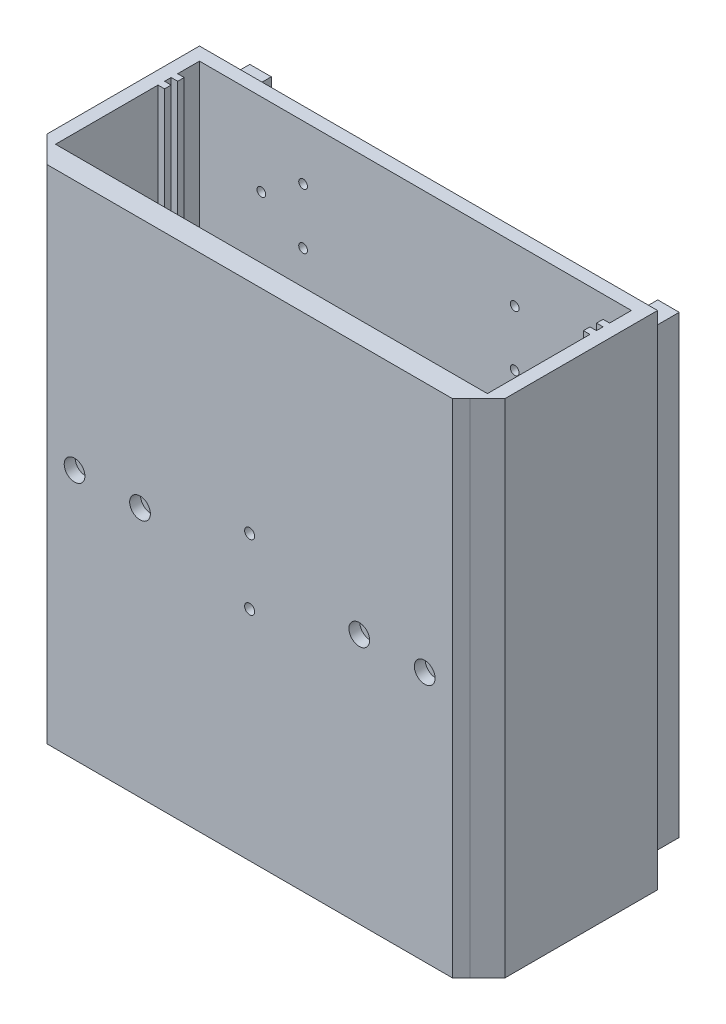
from build123d import *

# Parameters (mm, degrees)
SKETCH_1_W           = 210
SKETCH_1_H           = 230
EXTRUDE_1_DEPTH      = 6
SKETCH_2_W           = 9.85
SKETCH_2_H           = 208.5
EXTRUDE_3_DEPTH      = 15
SKETCH_3_R           = 2
CUT_EXTRUDE_1_DEPTH  = 10
SKETCH_17_W          = 6
SKETCH_17_H          = 230
EXTRUDE_9_DEPTH      = 66
EXTRUDE_10_DEPTH     = 6
CHAMFER_3_SIZE       = 8
SKETCH_21_R          = 2.3
CUT_EXTRUDE_9_DEPTH  = 6
SKETCH_34_R          = 2.25
CUT_EXTRUDE_14_DEPTH = 30
SKETCH_36_R          = 2.25
CUT_EXTRUDE_15_DEPTH = 30
SKETCH_51_W          = 194
SKETCH_51_H          = 230
EXTRUDE_22_DEPTH     = 4
CHAMFER_6_SIZE       = 4
CUT_EXTRUDE_START    = -5
SKETCH_54_R          = 4.75
SKETCH_54_R_2        = 2.3
CUT_EXTRUDE_21_DEPTH = 5
CUT_EXTRUDE_23_REACH = 324.062
SKETCH_60_W          = 25
SKETCH_60_H          = 30
SKETCH_61_W          = 3
SKETCH_61_H          = 3
EXTRUDE_25_DEPTH     = 230
SKETCH_63_W          = 5
SKETCH_63_H          = 8
EXTRUDE_26_DEPTH     = 3
SKETCH_65_W          = 5
SKETCH_65_H          = 8
EXTRUDE_27_DEPTH     = 3
SKETCH_64_R          = 1.15
CUT_EXTRUDE_24_DEPTH = 9
SKETCH_66_W          = 5
SKETCH_66_H          = 8
EXTRUDE_28_DEPTH     = 3
SKETCH_67_W          = 5
SKETCH_67_H          = 8
EXTRUDE_29_DEPTH     = 3
SKETCH_68_R          = 1.15
CUT_EXTRUDE_25_DEPTH = 9


with BuildPart() as part:
    # 草图1 → 凸台-拉伸1 (new body)
    with BuildSketch(Plane.XY):
        with Locations((105, 115)):
            Rectangle(SKETCH_1_W, SKETCH_1_H)
    extrude(amount=EXTRUDE_1_DEPTH)

    # 草图2 → 凸台-拉伸3 (add)
    with BuildSketch(Plane(origin=(0, 0, 0), x_dir=(-1, 0, 0), z_dir=(0, 0, -1))):
        with Locations((-200, 115)):
            Rectangle(SKETCH_2_W, SKETCH_2_H)
        with Locations((-13, 115)):
            Rectangle(SKETCH_2_W, SKETCH_2_H)
    extrude(amount=EXTRUDE_3_DEPTH)

    # 草图3 → 切除-拉伸1 (cut)
    with BuildSketch(Plane(origin=(0, 0, 0), x_dir=(-1, 0, 0), z_dir=(0, 0, -1))):
        with Locations((-169.6425573, 192.25)):
            Circle(SKETCH_3_R)
        with Locations((-150.5, 205)):
            Circle(SKETCH_3_R)
        with Locations((-150.5, 179.5)):
            Circle(SKETCH_3_R)
        with Locations(Location((-150.5, 50.5, 0), (0, 0, 180))):
            Circle(SKETCH_3_R)
        with Locations(Location((-150.5, 25, 0), (0, 0, 180))):
            Circle(SKETCH_3_R)
        with Locations(Location((-169.6425573, 37.75, 0), (0, 0, 180))):
            Circle(SKETCH_3_R)
        with Locations((-34.3574427, 192.25)):
            Circle(SKETCH_3_R)
        with Locations((-53.5, 205)):
            Circle(SKETCH_3_R)
        with Locations((-53.5, 179.5)):
            Circle(SKETCH_3_R)
        with Locations(Location((-53.5, 50.5, 0), (0, 0, 180))):
            Circle(SKETCH_3_R)
        with Locations(Location((-53.5, 25, 0), (0, 0, 180))):
            Circle(SKETCH_3_R)
        with Locations(Location((-34.3574427, 37.75, 0), (0, 0, 180))):
            Circle(SKETCH_3_R)
    extrude(amount=-CUT_EXTRUDE_1_DEPTH, mode=Mode.SUBTRACT)

    # 草图17 → 凸台-拉伸9 (add)
    with BuildSketch(Plane.XY.offset(6)):
        with Locations((3, 115)):
            Rectangle(SKETCH_17_W, SKETCH_17_H)
        with Locations((207, 115)):
            Rectangle(SKETCH_17_W, SKETCH_17_H)
    extrude(amount=EXTRUDE_9_DEPTH)

    # 草图18 → 凸台-拉伸10 (add)
    with BuildSketch(Plane.XY.offset(72)):
        Polygon((210, 230), (204, 230), (6, 230), (0, 230), (0, 0), (6, 0), (204, 0), (210, 0), align=None)
    extrude(amount=EXTRUDE_10_DEPTH)

    # 倒角3
    chamfer_3_edges = [part.edges().sort_by_distance(p)[0] for p in [
        (210, 115, 78),
        (0, 115, 78),
    ]]
    chamfer(chamfer_3_edges, length=CHAMFER_3_SIZE)

    # 草图21 → 切除-拉伸9 (cut)
    with BuildSketch(Plane.XY.offset(72)):
        with Locations((105, 130)):
            Circle(SKETCH_21_R)
        with Locations((105, 100)):
            Circle(SKETCH_21_R)
    extrude(amount=CUT_EXTRUDE_9_DEPTH, mode=Mode.SUBTRACT)

    # 草图34 → 切除-拉伸14 (cut)
    with BuildSketch(Plane(origin=(0, 0, 72), x_dir=(-1, 0, 0), z_dir=(0, 0, -1))):
        with Locations((-185.25, 115)):
            Circle(SKETCH_34_R)
        with Locations((-155.25, 115)):
            Circle(SKETCH_34_R)
    extrude(amount=-CUT_EXTRUDE_14_DEPTH, mode=Mode.SUBTRACT)

    # 草图36 → 切除-拉伸15 (cut)
    with BuildSketch(Plane(origin=(0, 0, 72), x_dir=(-1, 0, 0), z_dir=(0, 0, -1))):
        with Locations((-54.75, 115)):
            Circle(SKETCH_36_R)
        with Locations((-24.75, 115)):
            Circle(SKETCH_36_R)
    extrude(amount=-CUT_EXTRUDE_15_DEPTH, mode=Mode.SUBTRACT)

    # 草图51 → 凸台-拉伸22 (add)
    with BuildSketch(Plane.XY.offset(78)):
        with Locations((105, 115)):
            Rectangle(SKETCH_51_W, SKETCH_51_H)
    extrude(amount=EXTRUDE_22_DEPTH)

    # 倒角6
    chamfer_6_edges = [part.edges().sort_by_distance(p)[0] for p in [
        (202, 115, 82),
        (8, 115, 82),
    ]]
    chamfer(chamfer_6_edges, length=CHAMFER_6_SIZE - 0.0001)  # a hair under: the kernel refuses the full size

    # 草图54 → 切除-拉伸21 (cut)
    with BuildSketch(Plane.XY.offset(82).offset(CUT_EXTRUDE_START)):
        with Locations((54.75, 115)):
            Circle(SKETCH_54_R)
        with Locations((105, 130)):
            Circle(SKETCH_54_R_2)
        with Locations((105, 100)):
            Circle(SKETCH_54_R_2)
        with Locations((24.75, 115)):
            Circle(SKETCH_54_R)
        with Locations((155.25, 115)):
            Circle(SKETCH_54_R)
        with Locations((185.25, 115)):
            Circle(SKETCH_54_R)
    extrude(amount=CUT_EXTRUDE_21_DEPTH, mode=Mode.SUBTRACT)

    # 草图60 → 切除-拉伸23 (cut, up to next)
    with BuildSketch(Plane.ZY, mode=Mode.PRIVATE) as cut_extrude_23_sk1:
        with Locations((51.5, 115)):
            Rectangle(SKETCH_60_W, SKETCH_60_H)
    cut_extrude_23_tool1 = extrude(cut_extrude_23_sk1.sketch, amount=-CUT_EXTRUDE_23_REACH, mode=Mode.PRIVATE) & part.part
    add(cut_extrude_23_tool1.solids().sort_by_distance((0, 115, 51.5))[0], mode=Mode.SUBTRACT)

    # 草图61 → 凸台-拉伸25 (add)
    with BuildSketch(Plane.XZ):
        with Locations((7.5, 23.5)):
            Rectangle(SKETCH_61_W, SKETCH_61_H)
        with Locations((7.5, 17.5)):
            Rectangle(SKETCH_61_W, SKETCH_61_H)
        with Locations((202.5, 17.5)):
            Rectangle(SKETCH_61_W, SKETCH_61_H)
        with Locations((202.5, 23.5)):
            Rectangle(SKETCH_61_W, SKETCH_61_H)
    extrude(amount=-EXTRUDE_25_DEPTH)

    # 草图63 → 凸台-拉伸26 (add)
    with BuildSketch(Plane.XY.offset(25)):
        with Locations((11.5, 4)):
            Rectangle(SKETCH_63_W, SKETCH_63_H)
    extrude(amount=-EXTRUDE_26_DEPTH)

    # 草图65 → 凸台-拉伸27 (add)
    with BuildSketch(Plane.XY.offset(19)):
        with Locations((11.5, 4)):
            Rectangle(SKETCH_65_W, SKETCH_65_H)
    extrude(amount=-EXTRUDE_27_DEPTH)

    # 草图64 → 切除-拉伸24 (cut)
    with BuildSketch(Plane.XY.offset(25)):
        with Locations((10, 4)):
            Circle(SKETCH_64_R)
    extrude(amount=-CUT_EXTRUDE_24_DEPTH, mode=Mode.SUBTRACT)

    # 草图66 → 凸台-拉伸28 (add)
    with BuildSketch(Plane.XY.offset(25)):
        with Locations((198.5, 4)):
            Rectangle(SKETCH_66_W, SKETCH_66_H)
    extrude(amount=-EXTRUDE_28_DEPTH)

    # 草图67 → 凸台-拉伸29 (add)
    with BuildSketch(Plane.XY.offset(19)):
        with Locations((198.5, 4)):
            Rectangle(SKETCH_67_W, SKETCH_67_H)
    extrude(amount=-EXTRUDE_29_DEPTH)

    # 草图68 → 切除-拉伸25 (cut)
    with BuildSketch(Plane.XY.offset(25)):
        with Locations((200, 4)):
            Circle(SKETCH_68_R)
    extrude(amount=-CUT_EXTRUDE_25_DEPTH, mode=Mode.SUBTRACT)


solid = part.part
